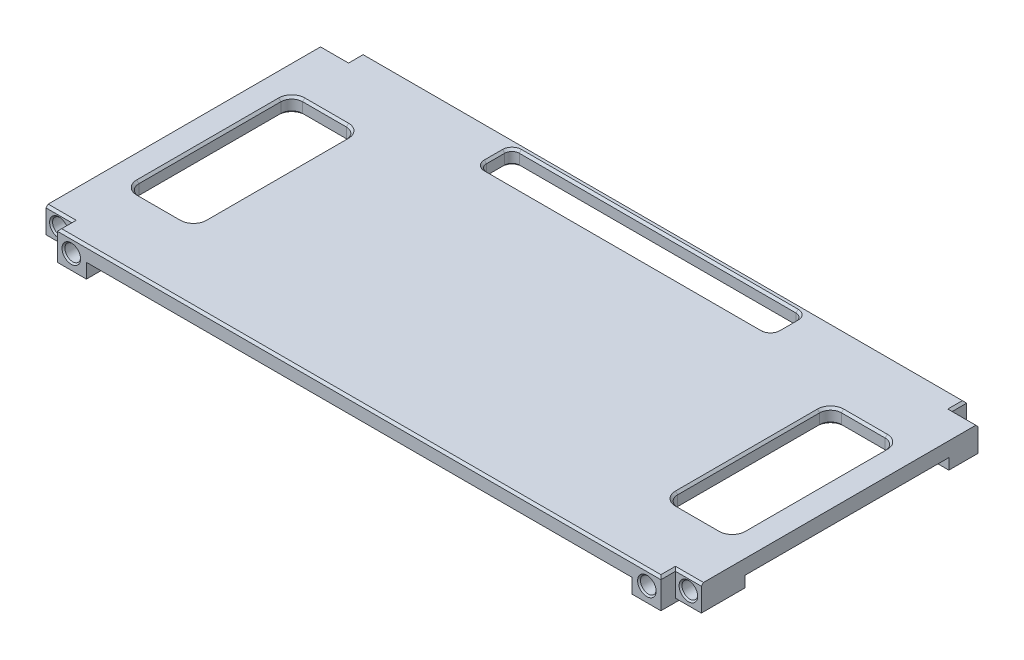
from build123d import *

# Parameters (mm, degrees)
BOSS_EXTRUDE1_DEPTH             = 4
SKETCH3_W                       = 7.1
SKETCH3_H                       = 8
BOSS_EXTRUDE3_DEPTH             = 3
SKETCH4_R                       = 2.15
CUT_EXTRUDE1_DEPTH              = 7
MIRROR2_COPY_1_SKETCH_W         = 7.1
MIRROR2_COPY_1_SKETCH_H         = 8
MIRROR2_COPY_1_DEPTH            = 3
MIRROR2_COPY_2_SKETCH_R         = 2.15
MIRROR2_COPY_2_DEPTH            = 7
SKETCH5_W                       = 80
SKETCH5_H                       = 9
CUT_EXTRUDE2_DEPTH              = 101.866248071
FILLET1_R                       = 2
SKETCH7_W                       = 165.8
SKETCH7_H                       = 1
CUT_EXTRUDE3_DEPTH              = 101.866248071
SKETCH8_W                       = 180
SKETCH8_H                       = 2
BOSS_EXTRUDE4_DEPTH             = 55
SKETCH9_W                       = 12
SKETCH9_H                       = 18
CUT_EXTRUDE4_DEPTH              = 10
SKETCH10_W                      = 7.1
SKETCH10_H                      = 4
BOSS_EXTRUDE5_DEPTH             = 3
SKETCH12_W                      = 1.5
SKETCH12_H                      = 4
BOSS_EXTRUDE6_DEPTH             = 2
SKETCH13_W                      = 90
SKETCH13_H                      = 2
BOSS_EXTRUDE7_DEPTH             = 55
SKETCH14_W                      = 1.5
SKETCH14_H                      = 4
BOSS_EXTRUDE8_DEPTH             = 1
BOSS_EXTRUDE9_REACH             = 116.285
BOSS_EXTRUDE9_DIRECTION_2_REACH = 116.285
SKETCH16_W                      = 20
SKETCH16_H                      = 14
SKETCH16_W_2                    = 14.5
SKETCH16_H_2                    = 9
BOSS_EXTRUDE10_DEPTH            = 4
SKETCH17_W                      = 12
SKETCH17_H                      = 18
CUT_EXTRUDE5_DEPTH              = 115.284732139
SKETCH18_W                      = 6
SKETCH18_H                      = 6
CUT_EXTRUDE6_DEPTH              = 117.262633722
SKETCH22_R                      = 1.25
CUT_EXTRUDE7_DEPTH              = 4
SKETCH25_W                      = 6
SKETCH25_H                      = 55
CUT_EXTRUDE11_DEPTH             = 10
CUT_EXTRUDE12_DEPTH             = 116.073889306
CUT_EXTRUDE12_DEPTH_BACK        = 116.073889306
SKETCH26_W                      = 3.576083065
SKETCH26_H                      = 29.903718591
SKETCH26_W_2                    = 12.269447076
SKETCH26_H_2                    = 28.524331859
SKETCH27_R                      = 1.25
CUT_EXTRUDE13_DEPTH             = 4
SKETCH28_W                      = 153.8
SKETCH28_H                      = 0.6
SKETCH28_W_2                    = 141.8
CUT_EXTRUDE14_DEPTH             = 117.262633722
SKETCH29_W                      = 141.8
SKETCH29_H                      = 1.4
CUT_EXTRUDE15_DEPTH             = 117.036890686
SKETCH30_W                      = 153.8
SKETCH30_H                      = 1.4
CUT_EXTRUDE16_DEPTH             = 117.036890686
SKETCH31_W                      = 2
SKETCH31_H                      = 4
CUT_EXTRUDE17_DEPTH             = 116.52056094
BOSS_EXTRUDE11_START            = -12
SKETCH32_W                      = 8
SKETCH32_H                      = 8
BOSS_EXTRUDE11_DEPTH            = 12
SKETCH33_R                      = 2.15
CUT_EXTRUDE18_DEPTH             = 10
MIRROR5_START                   = -30
MIRROR5_OUTLINE_W               = 8
MIRROR5_OUTLINE_H               = 8
MIRROR5_OUTLINE_R               = 2.15
MIRROR5_DEPTH                   = 72
MIRROR5_2_OUTLINE_R             = 2.15
MIRROR5_2_DEPTH                 = 62
SKETCH34_W                      = 20
SKETCH34_H                      = 16
CUT_EXTRUDE19_DEPTH             = 10
SKETCH35_W                      = 8
SKETCH35_H                      = 54
CUT_EXTRUDE20_DEPTH             = 4
SKETCH36_W                      = 14
SKETCH36_H                      = 6
BOSS_EXTRUDE12_DEPTH            = 1
SKETCH38_W                      = 14
SKETCH38_H                      = 6
BOSS_EXTRUDE13_DEPTH            = 3
CHAMFER1_SIZE                   = 1
SKETCH37_R                      = 1.6
CUT_EXTRUDE21_DEPTH             = 6
CHAMFER2_SIZE                   = 3
SKETCH39_W                      = 20
SKETCH39_H                      = 14
CUT_EXTRUDE22_DEPTH             = 16
SKETCH40_W                      = 16
SKETCH40_H                      = 16
CUT_EXTRUDE23_DEPTH             = 116.52056094
SKETCH41_R                      = 1.7
CUT_EXTRUDE24_DEPTH             = 4
SKETCH42_W                      = 180
SKETCH42_H                      = 52.5
CUT_EXTRUDE25_DEPTH             = 55
SKETCH43_W                      = 149.8
SKETCH43_H                      = 16
BOSS_EXTRUDE14_DEPTH            = 4
SKETCH44_W                      = 18
SKETCH44_H                      = 45
CUT_EXTRUDE26_DEPTH             = 100.639349657
SKETCH45_W                      = 149.238619459
SKETCH45_H                      = 56.887988606
BOSS_EXTRUDE15_DEPTH            = 4
FILLET2_R                       = 3
CHAMFER3_SIZE                   = 0.6
FILLET2_OF_MIRROR8_R            = 3
CHAMFER4_SIZE                   = 0.6
CHAMFER5_SIZE                   = 0.4


# Read off the part's stored shape, not the designer's step: Mirror5
with BuildPart() as part:
    # Sketch1 → Boss-Extrude1 (new body)
    with BuildSketch(Plane(origin=(0, 0, 0), x_dir=(1, 0, 0), z_dir=(0, 1, 0))):
        Polygon((-90, -38), (-82.9, -38), (-82.9, -45), (82.9, -45), (82.9, -38), (90, -38), (90, 38), (82.9, 38), (82.9, 45), (-82.9, 45), (-82.9, 38), (-90, 38), align=None)
    extrude(amount=BOSS_EXTRUDE1_DEPTH)

    # Sketch3 → Boss-Extrude3 (add)
    with BuildSketch(Plane.XZ):
        with Locations((-86.45, -34)):
            Rectangle(SKETCH3_W, SKETCH3_H)
    boss_extrude3 = extrude(amount=BOSS_EXTRUDE3_DEPTH)

    # Sketch4 → Cut-Extrude1 (cut)
    with BuildSketch(Plane(origin=(0, 0, -38), x_dir=(-1, 0, 0), z_dir=(0, 0, -1))):
        with Locations((86.45, 0.5)):
            Circle(SKETCH4_R)
    cut_extrude1 = extrude(amount=-CUT_EXTRUDE1_DEPTH, mode=Mode.SUBTRACT)

    # Mirror1: Boss-Extrude3, Cut-Extrude1 across plane
    add(boss_extrude3.mirror(Plane(origin=(0, 0, 0), x_dir=(0, 0, 1), z_dir=(1, 0, 0))))
    add(cut_extrude1.mirror(Plane(origin=(0, 0, 0), x_dir=(0, 0, 1), z_dir=(1, 0, 0))), mode=Mode.SUBTRACT)

    # Mirror2: Boss-Extrude3, Cut-Extrude1 across plane
    add(boss_extrude3.mirror(Plane.XY))
    add(cut_extrude1.mirror(Plane.XY), mode=Mode.SUBTRACT)

    # Mirror2 copy 1 sketch → Mirror2 copy 1 (add)
    with BuildSketch(Plane(origin=(0, 0, 0), x_dir=(-1, 0, 0), z_dir=(0, -1, 0))):
        with Locations((-86.45, -34)):
            Rectangle(MIRROR2_COPY_1_SKETCH_W, MIRROR2_COPY_1_SKETCH_H)
    extrude(amount=MIRROR2_COPY_1_DEPTH)

    # Mirror2 copy 2 sketch → Mirror2 copy 2 (cut)
    with BuildSketch(Plane.XY.offset(38)):
        with Locations((86.45, 0.5)):
            Circle(MIRROR2_COPY_2_SKETCH_R)
    extrude(amount=-MIRROR2_COPY_2_DEPTH, mode=Mode.SUBTRACT)

    # Sketch5 → Cut-Extrude2 (cut, through all)
    with BuildSketch(Plane(origin=(0, 4, 0), x_dir=(1, 0, 0), z_dir=(0, 1, 0))):
        with Locations((0, 35.5)):
            Rectangle(SKETCH5_W, SKETCH5_H)
    extrude(amount=-CUT_EXTRUDE2_DEPTH, mode=Mode.SUBTRACT)

    # Fillet1
    fillet1_edges = [part.edges().sort_by_distance(p)[0] for p in [
        (-40, 2, -31),
        (-40, 2, -40),
        (40, 2, -40),
        (40, 2, -31),
    ]]
    fillet(fillet1_edges, radius=FILLET1_R)

    # Sketch7 → Cut-Extrude3 (cut, through all)
    with BuildSketch(Plane(origin=(0, 4, 0), x_dir=(1, 0, 0), z_dir=(0, 1, 0))):
        with Locations((0, 44.5)):
            Rectangle(SKETCH7_W, SKETCH7_H)
        with Locations((0, -44.5)):
            Rectangle(SKETCH7_W, SKETCH7_H)
    extrude(amount=-CUT_EXTRUDE3_DEPTH, mode=Mode.SUBTRACT)

    # Sketch8 → Boss-Extrude4 (add)
    with BuildSketch(Plane.XZ):
        with Locations((0, 25)):
            Rectangle(SKETCH8_W, SKETCH8_H)
    extrude(amount=BOSS_EXTRUDE4_DEPTH)

    # Sketch9 → Cut-Extrude4 (cut)
    with BuildSketch(Plane(origin=(0, 4, 0), x_dir=(1, 0, 0), z_dir=(0, 1, 0))):
        with Locations((-76.9, -35)):
            Rectangle(SKETCH9_W, SKETCH9_H)
    extrude(amount=-CUT_EXTRUDE4_DEPTH, mode=Mode.SUBTRACT)

    # Sketch10 → Boss-Extrude5 (add)
    with BuildSketch(Plane.XZ.offset(3)):
        with Locations((-86.45, 28)):
            Rectangle(SKETCH10_W, SKETCH10_H)
        with Locations((86.45, 28)):
            Rectangle(SKETCH10_W, SKETCH10_H)
    extrude(amount=-BOSS_EXTRUDE5_DEPTH)

    # Sketch12 → Boss-Extrude6 (add)
    # profile 1 of 2: a face of its own
    with BuildSketch(Plane.ZY.offset(83)):
        Polygon((26, -5.8), (26, -16.2), (28.7, -13.5), (28.7, -8.5), align=None)
        with Locations((27.35, -11)):
            Rectangle(SKETCH12_W, SKETCH12_H, mode=Mode.SUBTRACT)
    # profile 2 of 2: a face of its own
    with BuildSketch(Plane.ZY.offset(83)):
        Polygon((26, -20.8), (26, -31.2), (28.7, -28.5), (28.7, -23.5), align=None)
        with Locations((27.35, -26)):
            Rectangle(SKETCH12_W, SKETCH12_H, mode=Mode.SUBTRACT)
    boss_extrude6 = extrude(amount=-BOSS_EXTRUDE6_DEPTH)

    # Mirror3: Boss-Extrude6 across plane
    add(boss_extrude6.mirror(Plane(origin=(-76.9, 0, 0), x_dir=(0, 0, 1), z_dir=(1, 0, 0))))

    # Sketch13 → Boss-Extrude7 (add)
    with BuildSketch(Plane.XZ):
        with Locations((0, -24.5)):
            Rectangle(SKETCH13_W, SKETCH13_H)
    extrude(amount=BOSS_EXTRUDE7_DEPTH)

    # Sketch14 → Boss-Extrude8 (add, symmetric)
    # profile 1 of 2: a face of its own
    with BuildSketch(Plane(origin=(0, 0, 0), x_dir=(0, 0, -1), z_dir=(1, 0, 0))):
        Polygon((28.2, -8.5), (25.5, -5.8), (25.5, -16.2), (28.2, -13.5), align=None)
        with Locations((26.85, -11)):
            Rectangle(SKETCH14_W, SKETCH14_H, mode=Mode.SUBTRACT)
    # profile 2 of 2: a face of its own
    with BuildSketch(Plane(origin=(0, 0, 0), x_dir=(0, 0, -1), z_dir=(1, 0, 0))):
        Polygon((28.2, -28.5), (28.2, -23.5), (25.5, -20.8), (25.5, -31.2), align=None)
        with Locations((26.85, -26)):
            Rectangle(SKETCH14_W, SKETCH14_H, mode=Mode.SUBTRACT)
    extrude(amount=BOSS_EXTRUDE8_DEPTH, both=True)

    # Boss-Extrude9: up to this face of the body (flat: up to its plane)
    boss_extrude9_end = Plane(part.part.faces().sort_by_distance((-45, -27.5, -24.5))[0])
    # Sketch15 → Boss-Extrude9 (add, up to the picked face)
    with BuildSketch(Plane(origin=(0, 0, 0), x_dir=(0, 0, -1), z_dir=(1, 0, 0)), mode=Mode.PRIVATE) as boss_extrude9_sk1:
        Polygon((23.5, 0), (23.5, -5), (20.613248654, 0), align=None)
    boss_extrude9_tool1 = split(extrude(boss_extrude9_sk1.sketch, amount=-BOSS_EXTRUDE9_REACH, mode=Mode.PRIVATE), bisect_by=boss_extrude9_end, keep=Keep.BOTH, mode=Mode.PRIVATE)
    add(boss_extrude9_tool1.solids().sort_by(Axis((0, -1.666667, -22.53775), (-1, 0, 0)))[0])

    # Boss-Extrude9 direction 2: up to this face of the body (flat: up to its plane)
    boss_extrude9_direction_2_end = Plane(part.part.faces().sort_by_distance((45, -27.5, -24.5))[0])
    # Sketch15 → Boss-Extrude9 direction 2 (add, up to the picked face)
    with BuildSketch(Plane(origin=(0, 0, 0), x_dir=(0, 0, -1), z_dir=(1, 0, 0)), mode=Mode.PRIVATE) as boss_extrude9_direction_2_sk1:
        Polygon((23.5, 0), (23.5, -5), (20.613248654, 0), align=None)
    boss_extrude9_direction_2_tool1 = split(extrude(boss_extrude9_direction_2_sk1.sketch, amount=BOSS_EXTRUDE9_DIRECTION_2_REACH, mode=Mode.PRIVATE), bisect_by=boss_extrude9_direction_2_end, keep=Keep.BOTH, mode=Mode.PRIVATE)
    add(boss_extrude9_direction_2_tool1.solids().sort_by(Axis((0, -1.666667, -22.53775), (1, 0, 0)))[0])

    # Sketch16 → Boss-Extrude10 (add)
    with BuildSketch(Plane.XY.offset(44)):
        with Locations((57, -7)):
            Rectangle(SKETCH16_W, SKETCH16_H)
        with Locations((57, -7)):
            Rectangle(SKETCH16_W_2, SKETCH16_H_2, mode=Mode.SUBTRACT)
    extrude(amount=-BOSS_EXTRUDE10_DEPTH)

    # Sketch17 → Cut-Extrude5 (cut, through all)
    with BuildSketch(Plane.XZ):
        with Locations((76.9, 35)):
            Rectangle(SKETCH17_W, SKETCH17_H)
    extrude(amount=-CUT_EXTRUDE5_DEPTH, mode=Mode.SUBTRACT)

    # Sketch18 → Cut-Extrude6 (cut, through all)
    with BuildSketch(Plane(origin=(0, 4, 0), x_dir=(1, 0, 0), z_dir=(0, 1, 0))):
        with Locations((79.9, 41)):
            Rectangle(SKETCH18_W, SKETCH18_H)
        with Locations((-79.9, 41)):
            Rectangle(SKETCH18_W, SKETCH18_H)
    extrude(amount=-CUT_EXTRUDE6_DEPTH, mode=Mode.SUBTRACT)

    # Sketch22 → Cut-Extrude7 (cut)
    with BuildSketch(Plane(origin=(0, 4, 0), x_dir=(1, 0, 0), z_dir=(0, 1, 0))):
        with Locations(Location((31, 21, 0), (0, 0, 270))):
            Circle(SKETCH22_R)
        with Locations(Location((-31, -21, 0), (0, 0, 270))):
            Circle(SKETCH22_R)
    extrude(amount=-CUT_EXTRUDE7_DEPTH, mode=Mode.SUBTRACT)

    # Sketch25 → Cut-Extrude11 (cut)
    with BuildSketch(Plane(origin=(0, 0, -25.5), x_dir=(-1, 0, 0), z_dir=(0, 0, -1))):
        with Locations((-42, -27.5)):
            Rectangle(SKETCH25_W, SKETCH25_H)
        with Locations((42, -27.5)):
            Rectangle(SKETCH25_W, SKETCH25_H)
    extrude(amount=-CUT_EXTRUDE11_DEPTH, mode=Mode.SUBTRACT)

    # Sketch26 → Cut-Extrude12 (cut, two sides: drawn at the far end of the back side and taken through both)
    with BuildSketch(Plane.ZY.offset(1).offset(-CUT_EXTRUDE12_DEPTH_BACK)):
        with Locations((-27.288041533, -20.751859296)):
            Rectangle(SKETCH26_W, SKETCH26_H)
        with Locations((32.134723538, -20.06216593)):
            Rectangle(SKETCH26_W_2, SKETCH26_H_2)
    extrude(amount=CUT_EXTRUDE12_DEPTH + CUT_EXTRUDE12_DEPTH_BACK, mode=Mode.SUBTRACT)

    # Sketch27 → Cut-Extrude13 (cut)
    with BuildSketch(Plane(origin=(0, 4, 0), x_dir=(1, 0, 0), z_dir=(0, 1, 0))):
        with Locations(Location((-36, 24.5, 0), (0, 0, 270))):
            Circle(SKETCH27_R)
        with Locations(Location((-36, -32.5, 0), (0, 0, 270))):
            Circle(SKETCH27_R)
        with Locations(Location((36, -32.5, 0), (0, 0, 270))):
            Circle(SKETCH27_R)
        with Locations(Location((36, 24.5, 0), (0, 0, 270))):
            Circle(SKETCH27_R)
    extrude(amount=-CUT_EXTRUDE13_DEPTH, mode=Mode.SUBTRACT)

    # Sketch28 → Cut-Extrude14 (cut, through all)
    with BuildSketch(Plane(origin=(0, 4, 0), x_dir=(1, 0, 0), z_dir=(0, 1, 0))):
        with Locations((0, 43.7)):
            Rectangle(SKETCH28_W, SKETCH28_H)
        with Locations((0, -43.7)):
            Rectangle(SKETCH28_W_2, SKETCH28_H)
    extrude(amount=-CUT_EXTRUDE14_DEPTH, mode=Mode.SUBTRACT)

    # Sketch29 → Cut-Extrude15 (cut, through all)
    with BuildSketch(Plane(origin=(0, 4, 0), x_dir=(1, 0, 0), z_dir=(0, 1, 0))):
        with Locations((0, -42.7)):
            Rectangle(SKETCH29_W, SKETCH29_H)
    extrude(amount=-CUT_EXTRUDE15_DEPTH, mode=Mode.SUBTRACT)

    # Sketch30 → Cut-Extrude16 (cut, through all)
    with BuildSketch(Plane(origin=(0, 4, 0), x_dir=(1, 0, 0), z_dir=(0, 1, 0))):
        with Locations((0, 42.7)):
            Rectangle(SKETCH30_W, SKETCH30_H)
    extrude(amount=-CUT_EXTRUDE16_DEPTH, mode=Mode.SUBTRACT)

    # Sketch31 → Cut-Extrude17 (cut, through all)
    with BuildSketch(Plane(origin=(0, 4, 0), x_dir=(1, 0, 0), z_dir=(0, 1, 0))):
        with Locations((-75.9, 40)):
            Rectangle(SKETCH31_W, SKETCH31_H)
        with Locations((75.9, 40)):
            Rectangle(SKETCH31_W, SKETCH31_H)
    extrude(amount=-CUT_EXTRUDE17_DEPTH, mode=Mode.SUBTRACT)

    # Sketch32 → Boss-Extrude11 (add)
    with BuildSketch(Plane(origin=(0, 0, -42), x_dir=(-1, 0, 0), z_dir=(0, 0, -1)).offset(BOSS_EXTRUDE11_START)):
        with Locations((-78.9, 0)):
            Rectangle(SKETCH32_W, SKETCH32_H)
    boss_extrude11 = extrude(amount=BOSS_EXTRUDE11_DEPTH)

    # Sketch33 → Cut-Extrude18 (cut)
    with BuildSketch(Plane(origin=(0, 0, -42), x_dir=(-1, 0, 0), z_dir=(0, 0, -1))):
        with Locations((-79.05, 0)):
            Circle(SKETCH33_R)
    cut_extrude18 = extrude(amount=-CUT_EXTRUDE18_DEPTH, mode=Mode.SUBTRACT)

    # Mirror4: Boss-Extrude11, Cut-Extrude18 across plane
    add(boss_extrude11.mirror(Plane(origin=(0, 0, 0), x_dir=(0, 0, 1), z_dir=(1, 0, 0))))
    add(cut_extrude18.mirror(Plane(origin=(0, 0, 0), x_dir=(0, 0, 1), z_dir=(1, 0, 0))), mode=Mode.SUBTRACT)

    # Mirror5 outline → Mirror5 (add)
    # profile 1 of 2: a face of its own
    with BuildSketch(Plane.XY.offset(MIRROR5_START)):
        with Locations((78.9, 0)):
            Rectangle(MIRROR5_OUTLINE_W, MIRROR5_OUTLINE_H)
        with Locations((79.05, 0)):
            Circle(MIRROR5_OUTLINE_R, mode=Mode.SUBTRACT)
    # profile 2 of 2: a face of its own
    with BuildSketch(Plane.XY.offset(MIRROR5_START)):
        with Locations((-78.9, 0)):
            Rectangle(MIRROR5_OUTLINE_W, MIRROR5_OUTLINE_H)
        with Locations((-79.05, 0)):
            Circle(MIRROR5_OUTLINE_R, mode=Mode.SUBTRACT)
    extrude(amount=MIRROR5_DEPTH)

    # Mirror5 2 outline → Mirror5 2 (add)
    with BuildSketch(Plane.XY.offset(MIRROR5_START)):
        with Locations((79.05, 0)):
            Circle(MIRROR5_2_OUTLINE_R)
        with Locations((-79.05, 0)):
            Circle(MIRROR5_2_OUTLINE_R)
    extrude(amount=MIRROR5_2_DEPTH)

    # Sketch34 → Cut-Extrude19 (cut)
    with BuildSketch(Plane(origin=(0, 4, 0), x_dir=(1, 0, 0), z_dir=(0, 1, 0))):
        with Locations((-60.9, -34)):
            Rectangle(SKETCH34_W, SKETCH34_H)
    extrude(amount=-CUT_EXTRUDE19_DEPTH, mode=Mode.SUBTRACT)

    # Sketch35 → Cut-Extrude20 (cut)
    with BuildSketch(Plane.XZ.offset(4)):
        with Locations((-78.9, -3)):
            Rectangle(SKETCH35_W, SKETCH35_H)
        with Locations((78.9, -3)):
            Rectangle(SKETCH35_W, SKETCH35_H)
    extrude(amount=-CUT_EXTRUDE20_DEPTH, mode=Mode.SUBTRACT)

    # Sketch36 → Boss-Extrude12 (add)
    with BuildSketch(Plane(origin=(0, 0, -25.5), x_dir=(-1, 0, 0), z_dir=(0, 0, -1))):
        with Locations((0, -19)):
            Rectangle(SKETCH36_W, SKETCH36_H)
    extrude(amount=BOSS_EXTRUDE12_DEPTH)

    # Sketch38 → Boss-Extrude13 (add)
    with BuildSketch(Plane.XY.offset(-23.5)):
        with Locations((0, -19)):
            Rectangle(SKETCH38_W, SKETCH38_H)
    extrude(amount=BOSS_EXTRUDE13_DEPTH)

    # Chamfer1
    chamfer1_edges = [part.edges().sort_by_distance(p)[0] for p in [
        (0, -16, -25.5),
    ]]
    chamfer(chamfer1_edges, length=CHAMFER1_SIZE - 0.0001)  # a hair under: the kernel refuses the full size

    # Sketch37 → Cut-Extrude21 (cut)
    with BuildSketch(Plane(origin=(0, 0, -26.5), x_dir=(-1, 0, 0), z_dir=(0, 0, -1))):
        with Locations((-4, -19)):
            Circle(SKETCH37_R)
        with Locations((4, -19)):
            Circle(SKETCH37_R)
    extrude(amount=-CUT_EXTRUDE21_DEPTH, mode=Mode.SUBTRACT)

    # Chamfer2
    chamfer2_edges = [part.edges().sort_by_distance(p)[0] for p in [
        (0, -16, -23.5),
    ]]
    chamfer(chamfer2_edges, length=CHAMFER2_SIZE - 0.0001)  # a hair under: the kernel refuses the full size

    # Sketch39 → Cut-Extrude22 (cut)
    with BuildSketch(Plane.XY.offset(42)):
        with Locations((57, -7)):
            Rectangle(SKETCH39_W, SKETCH39_H)
    extrude(amount=-CUT_EXTRUDE22_DEPTH, mode=Mode.SUBTRACT)

    # Sketch40 → Cut-Extrude23 (cut, through all)
    with BuildSketch(Plane(origin=(0, 4, 0), x_dir=(1, 0, 0), z_dir=(0, 1, 0))):
        with Locations((62.9, -34)):
            Rectangle(SKETCH40_W, SKETCH40_H)
    extrude(amount=-CUT_EXTRUDE23_DEPTH, mode=Mode.SUBTRACT)

    # Sketch41 → Cut-Extrude24 (cut)
    with BuildSketch(Plane(origin=(0, 4, 0), x_dir=(1, 0, 0), z_dir=(0, 1, 0))):
        with Locations(Location((-80, -15, 0), (0, 0, 270))):
            Circle(SKETCH41_R)
        with Locations(Location((-70, -15, 0), (0, 0, 270))):
            Circle(SKETCH41_R)
        with Locations(Location((-60, -15, 0), (0, 0, 270))):
            Circle(SKETCH41_R)
        with Locations(Location((-50, -15, 0), (0, 0, 270))):
            Circle(SKETCH41_R)
        with Locations(Location((-40, -15, 0), (0, 0, 270))):
            Circle(SKETCH41_R)
        with Locations(Location((-70, -5, 0), (0, 0, 270))):
            Circle(SKETCH41_R)
        with Locations(Location((-60, -5, 0), (0, 0, 270))):
            Circle(SKETCH41_R)
        with Locations(Location((-50, -5, 0), (0, 0, 270))):
            Circle(SKETCH41_R)
        with Locations(Location((-40, -5, 0), (0, 0, 270))):
            Circle(SKETCH41_R)
        with Locations(Location((-70, 5, 0), (0, 0, 270))):
            Circle(SKETCH41_R)
        with Locations(Location((-60, 5, 0), (0, 0, 270))):
            Circle(SKETCH41_R)
        with Locations(Location((-50, 5, 0), (0, 0, 270))):
            Circle(SKETCH41_R)
        with Locations(Location((-40, 5, 0), (0, 0, 270))):
            Circle(SKETCH41_R)
        with Locations(Location((-70, 15, 0), (0, 0, 270))):
            Circle(SKETCH41_R)
        with Locations(Location((-60, 15, 0), (0, 0, 270))):
            Circle(SKETCH41_R)
        with Locations(Location((-50, 15, 0), (0, 0, 270))):
            Circle(SKETCH41_R)
        with Locations(Location((-40, 15, 0), (0, 0, 270))):
            Circle(SKETCH41_R)
        with Locations(Location((-80, -5, 0), (0, 0, 270))):
            Circle(SKETCH41_R)
        with Locations(Location((-80, 5, 0), (0, 0, 270))):
            Circle(SKETCH41_R)
        with Locations(Location((-80, 15, 0), (0, 0, 270))):
            Circle(SKETCH41_R)
    cut_extrude24 = extrude(amount=-CUT_EXTRUDE24_DEPTH, mode=Mode.SUBTRACT)

    # Mirror6: Cut-Extrude24 across plane
    add(cut_extrude24.mirror(Plane(origin=(0, 0, 0), x_dir=(0, 0, 1), z_dir=(1, 0, 0))), mode=Mode.SUBTRACT)

    # Sketch42 → Cut-Extrude25 (cut)
    with BuildSketch(Plane.XZ.offset(55)):
        with Locations((0, -0.25)):
            Rectangle(SKETCH42_W, SKETCH42_H)
    extrude(amount=-CUT_EXTRUDE25_DEPTH, mode=Mode.SUBTRACT)

    # Sketch43 → Boss-Extrude14 (add)
    with BuildSketch(Plane.XZ):
        with Locations((0, 34)):
            Rectangle(SKETCH43_W, SKETCH43_H)
    extrude(amount=-BOSS_EXTRUDE14_DEPTH)

    # Sketch44 → Cut-Extrude26 (cut, through all)
    with BuildSketch(Plane(origin=(0, 4, 0), x_dir=(1, 0, 0), z_dir=(0, 1, 0))):
        with Locations((-74, 0)):
            Rectangle(SKETCH44_W, SKETCH44_H)
    cut_extrude26 = extrude(amount=-CUT_EXTRUDE26_DEPTH, mode=Mode.SUBTRACT)

    # Sketch45 → Boss-Extrude15 (add)
    with BuildSketch(Plane(origin=(0, 4, 0), x_dir=(1, 0, 0), z_dir=(0, 1, 0))):
        with Locations((11.82088075, -1.292908832)):
            Rectangle(SKETCH45_W, SKETCH45_H)
    extrude(amount=-BOSS_EXTRUDE15_DEPTH)

    # Fillet2
    fillet2_edges = [part.edges().sort_by_distance(p)[0] for p in [
        (-83, 2, 22.5),
        (-83, 2, -22.5),
        (-65, 2, -22.5),
        (-65, 2, 22.5),
    ]]
    fillet(fillet2_edges, radius=FILLET2_R)

    # Chamfer3
    chamfer3_edges = [part.edges().sort_by_distance(p)[0] for p in [
        (-40, 4, -35.5),
        (-40, 0, -35.5),
        (0, 4, -40),
        (0, 0, -40),
        (0, 4, -31),
        (0, 0, -31),
        (40, 4, -35.5),
        (40, 0, -35.5),
        (-39.414213562, 4, -39.414213562),
        (-39.414213562, 0, -39.414213562),
        (-39.414213562, 4, -31.585786438),
        (-39.414213562, 0, -31.585786438),
        (39.414213562, 4, -39.414213562),
        (39.414213562, 0, -39.414213562),
        (39.414213562, 4, -31.585786438),
        (39.414213562, 0, -31.585786438),
        (-74, 4, 22.5),
        (-74, 0, 22.5),
        (-83, 4, 0),
        (-83, 0, 0),
        (-65, 4, 0),
        (-65, 0, 0),
        (-74, 4, -22.5),
        (-74, 0, -22.5),
        (-82.121320344, 4, 21.621320344),
        (-82.121320344, 0, 21.621320344),
        (-65.878679656, 4, 21.621320344),
        (-65.878679656, 0, 21.621320344),
        (-65.878679656, 4, -21.621320344),
        (-65.878679656, 0, -21.621320344),
        (-82.121320344, 4, -21.621320344),
        (-82.121320344, 0, -21.621320344),
        (-86.45, 4, 38),
        (86.45, 4, 38),
        (86.45, 4, -38),
        (0, 4, -42),
        (82.9, 4, -40),
        (-86.45, 4, -38),
        (-82.9, 4, -40),
        (-82.9, 4, 40),
        (0, 4, 42),
        (82.9, 4, 40),
    ]]
    chamfer(chamfer3_edges, length=CHAMFER3_SIZE)

    # Mirror8: Cut-Extrude26 across plane
    add(cut_extrude26.mirror(Plane(origin=(0, 0, 0), x_dir=(0, 0, 1), z_dir=(1, 0, 0))), mode=Mode.SUBTRACT)

    # Fillet2 of Mirror8
    fillet2_of_mirror8_edges = [part.edges().sort_by_distance(p)[0] for p in [
        (83, 2, 22.5),
        (83, 2, -22.5),
        (65, 2, -22.5),
        (65, 2, 22.5),
    ]]
    fillet(fillet2_of_mirror8_edges, radius=FILLET2_OF_MIRROR8_R)

    # Chamfer4
    chamfer4_edges = [part.edges().sort_by_distance(p)[0] for p in [
        (83, 0, 0),
        (83, 4, 0),
        (74, 0, 22.5),
        (74, 4, 22.5),
        (65, 0, 0),
        (65, 4, 0),
        (74, 0, -22.5),
        (74, 4, -22.5),
        (82.121320344, 4, 21.621320344),
        (82.121320344, 0, 21.621320344),
        (65.878679656, 4, 21.621320344),
        (65.878679656, 0, 21.621320344),
        (65.878679656, 4, -21.621320344),
        (65.878679656, 0, -21.621320344),
        (82.121320344, 4, -21.621320344),
        (82.121320344, 0, -21.621320344),
    ]]
    chamfer(chamfer4_edges, length=CHAMFER4_SIZE)

    # Chamfer5
    chamfer5_edges = [part.edges().sort_by_distance(p)[0] for p in [
        (-84.3, 0.5, -38),
        (84.3, 0.5, -38),
        (-84.3, 0.5, 38),
        (81.2, 0, -42),
        (-81.2, 0, -42),
        (-81.2, 0, 42),
        (76.9, 0, 42),
        (84.3, 0.5, 38),
    ]]
    chamfer(chamfer5_edges, length=CHAMFER5_SIZE)


solid = part.part
